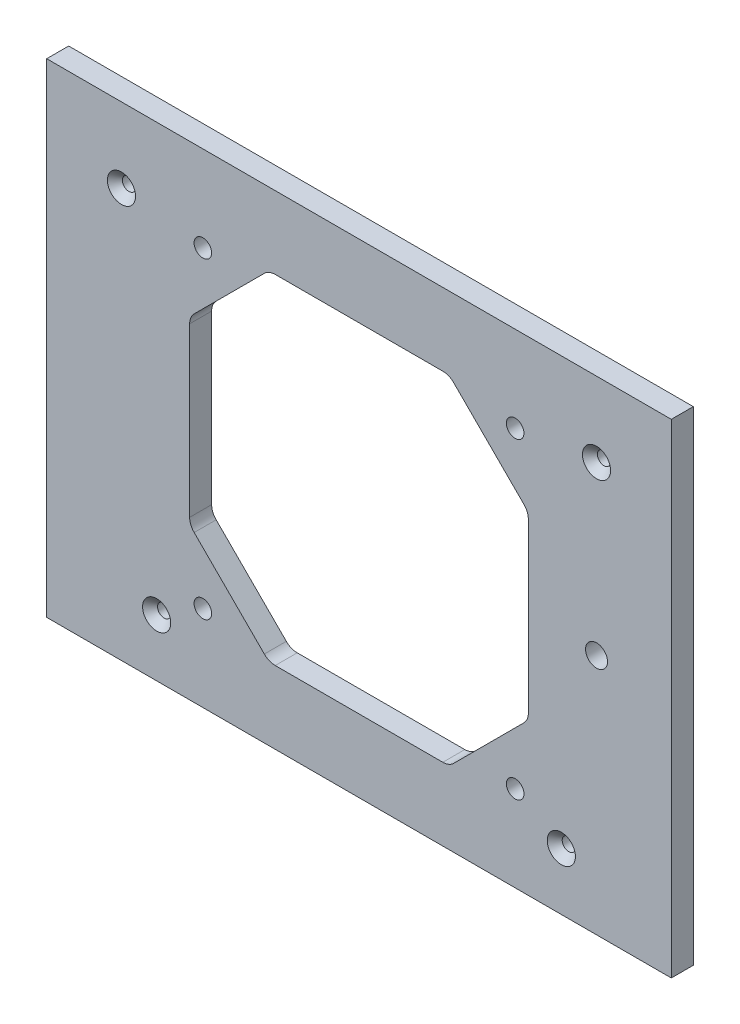
from build123d import *

# Parameters (mm, degrees)
SKETCH1_W           = 142
SKETCH1_H           = 110
BOSS_EXTRUDE1_DEPTH = 2.5
SKETCH3_R           = 1.5
TOPCOVERHOLES_DEPTH = 90.949986103
SKETCH5_R           = 1.5
CUT_EXTRUDE1_DEPTH  = 90.949986103
CHAMFER1_SIZE       = 1.7
SKETCH7_R           = 2
FAN_DEPTH           = 90.949986103
SKETCH8_R           = 2.5
FORLED_DEPTH        = 90.949986103
FILLET1_R           = 3.5


with BuildPart() as part:
    # Sketch1 → Boss-Extrude1 (new, symmetric)
    with BuildSketch(Plane.XY):
        Rectangle(SKETCH1_W, SKETCH1_H)
    extrude(amount=BOSS_EXTRUDE1_DEPTH, both=True)

    # Sketch3 → TopCoverHoles (cut, through all)
    with BuildSketch(Plane.XY.offset(2.5)):
        with Locations((-54, 38)):
            Circle(SKETCH3_R)
        with Locations((54, 38)):
            Circle(SKETCH3_R)
    extrude(amount=-TOPCOVERHOLES_DEPTH, mode=Mode.SUBTRACT)

    # Sketch5 → Cut-Extrude1 (cut, through all)
    with BuildSketch(Plane.XY.offset(2.5)):
        with Locations((46, -42)):
            Circle(SKETCH5_R)
        with Locations((-46, -42)):
            Circle(SKETCH5_R)
    extrude(amount=-CUT_EXTRUDE1_DEPTH, mode=Mode.SUBTRACT)

    # Chamfer1
    chamfer1_edges = [part.edges().sort_by_distance(p)[0] for p in [
        (52.5, 38, 2.5),
        (-55.5, 38, 2.5),
        (44.5, -42, 2.5),
        (-47.5, -42, 2.5),
    ]]
    chamfer(chamfer1_edges, length=CHAMFER1_SIZE)

    # Sketch7 → Fan (cut, through all)
    with BuildSketch(Plane.XY.offset(2.5)):
        with Locations((-35.5, -35.5)):
            Circle(SKETCH7_R)
        with Locations((35.5, -35.5)):
            Circle(SKETCH7_R)
        with Locations((35.5, 35.5)):
            Circle(SKETCH7_R)
        with Locations((-35.5, 35.5)):
            Circle(SKETCH7_R)
        Polygon((-20.5, 38.5), (-38.5, 20.5), (-38.5, -20.5), (-20.5, -38.5), (20.5, -38.5), (38.5, -20.5), (38.5, 20.5), (20.5, 38.5), align=None)
    extrude(amount=-FAN_DEPTH, mode=Mode.SUBTRACT)

    # Sketch8 → ForLED (cut, through all)
    with BuildSketch(Plane.XY.offset(2.5)):
        with Locations((54, 0)):
            Circle(SKETCH8_R)
    extrude(amount=-FORLED_DEPTH, mode=Mode.SUBTRACT)

    # Fillet1
    fillet1_edges = [part.edges().sort_by_distance(p)[0] for p in [
        (38.5, 20.5, 0),
        (38.5, -20.5, 0),
        (20.5, -38.5, 0),
        (-38.5, -20.5, 0),
        (-38.5, 20.5, 0),
        (-20.5, 38.5, 0),
        (20.5, 38.5, 0),
        (-20.5, -38.5, 0),
    ]]
    fillet(fillet1_edges, radius=FILLET1_R)


solid = part.part
